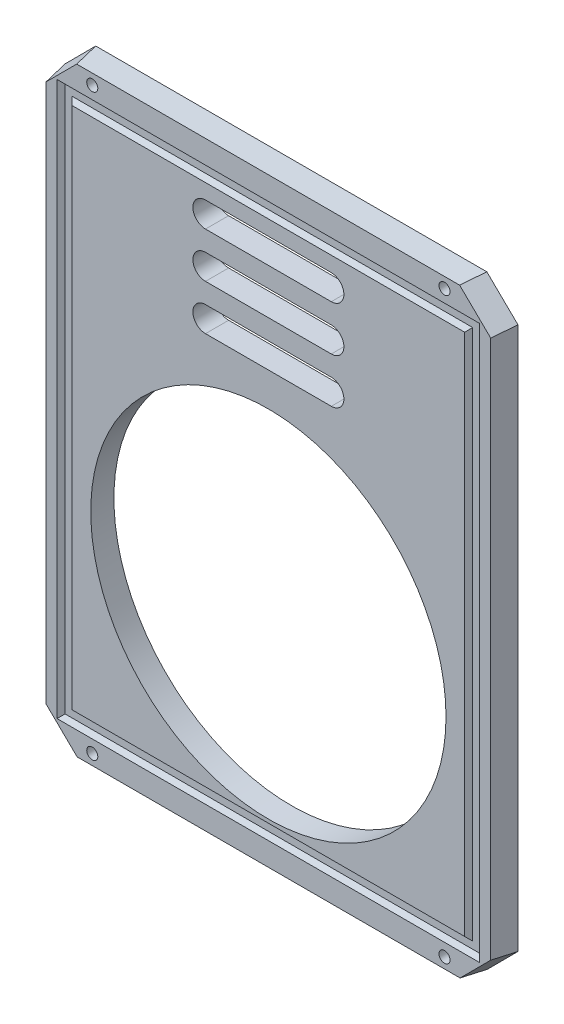
from build123d import *
from OCP.BRepFilletAPI import BRepFilletAPI_MakeChamfer

# Parameters (mm, degrees)
SKETCH1_W               = 114.3
SKETCH1_H               = 152.4
SKETCH1_R               = 44.831
SKETCH1_R_2             = 1.397
BOSS_EXTRUDE1_DEPTH     = 5.842
DRAFT1_ANGLE            = -5
DRAFT2_ANGLE            = -10
SKETCH2_W               = 104.14
SKETCH2_H               = 137.16
SKETCH2_W_2             = 101.6
SKETCH2_H_2             = 134.62
CUT_EXTRUDE_THIN1_DEPTH = 1.016
CHAMFER2_SIZE           = 7.62
CHAMFER2_SIZE2          = 7.737996461
CUT_EXTRUDE1_DEPTH      = 7.62


with BuildPart() as part:
    # Sketch1 → Boss-Extrude1 (new body)
    with BuildSketch(Plane.XY):
        Rectangle(SKETCH1_W, SKETCH1_H)
        with Locations((0, -20.32)):
            Circle(SKETCH1_R, mode=Mode.SUBTRACT)
        with Locations((-44.45, 73.025)):
            Circle(SKETCH1_R_2, mode=Mode.SUBTRACT)
        with Locations((44.45, 73.025)):
            Circle(SKETCH1_R_2, mode=Mode.SUBTRACT)
        with Locations((44.45, -73.025)):
            Circle(SKETCH1_R_2, mode=Mode.SUBTRACT)
        with Locations((-44.45, -73.025)):
            Circle(SKETCH1_R_2, mode=Mode.SUBTRACT)
    extrude(amount=BOSS_EXTRUDE1_DEPTH)

    # Draft1
    draft1_faces = [part.faces().sort_by_distance(p)[0] for p in [
        (0, 76.2, 2.921),
        (0, -76.2, 2.921),
    ]]
    draft(draft1_faces, Plane(origin=(0, 0, 0), x_dir=(-1, 0, 0), z_dir=(0, 0, -1)), DRAFT1_ANGLE)

    # Draft2
    draft2_faces = [part.faces().sort_by_distance(p)[0] for p in [
        (57.15, 0, 2.917723595),
        (-57.15, 0, 2.917723595),
    ]]
    draft(draft2_faces, Plane(origin=(0, 0, 0), x_dir=(-1, 0, 0), z_dir=(0, 0, -1)), DRAFT2_ANGLE)

    # Sketch2 → Cut-Extrude-Thin1 (cut)
    with BuildSketch(Plane.XY.offset(5.842)):
        Rectangle(SKETCH2_W, SKETCH2_H)
        Rectangle(SKETCH2_W_2, SKETCH2_H_2, mode=Mode.SUBTRACT)
    extrude(amount=-CUT_EXTRUDE_THIN1_DEPTH, mode=Mode.SUBTRACT)

    # Chamfer1
    # the kernel refuses this chamfer: 1.27 mm, written as the material it takes off along each edge
    with BuildSketch(Plane(origin=(50.8, 67.31, 5.842), x_dir=(-0.9996219169112968, 0, 0.02749587661058659), z_dir=(0, -1, 0))) as chamfer1_piece_1_section:
        with BuildLine():
            Line((1.306414958, 0), (-0.071814887, 1.304439598))
            Line((-0.071814887, 1.304439598), (-0.097205283, 1.303741203))
            ThreePointArc((-0.097205283, 1.303741203), (-0.043344118, 0.652015244), (-0.025390397, -0.000698395))
            Line((-0.025390397, -0.000698395), (0.000698395, -0.025390397))
            ThreePointArc((0.000698395, -0.025390397), (0.653412034, -0.007436675), (1.307113353, -0.025390397))
            Line((1.307113353, -0.025390397), (1.306414958, 0))
        make_face()
    chamfer1_piece_1 = extrude(amount=134.62, mode=Mode.PRIVATE)
    chamfer1_piece_1 = split(chamfer1_piece_1, bisect_by=Plane(origin=(50.360937616, 0, 4.826), z_dir=(0, 0, 1)), keep=Keep.TOP, mode=Mode.PRIVATE)
    add(chamfer1_piece_1, mode=Mode.SUBTRACT)
    with BuildSketch(Plane(origin=(50.8, -67.31, 5.842), x_dir=(0, 0.9996219169112968, 0.02749587661058659), z_dir=(-1, 0, 0))) as chamfer1_piece_2_section:
        with BuildLine():
            Line((1.306414958, 0), (-0.071814887, 1.304439598))
            Line((-0.071814887, 1.304439598), (-0.097205283, 1.303741203))
            ThreePointArc((-0.097205283, 1.303741203), (-0.043344118, 0.652015244), (-0.025390397, -0.000698395))
            Line((-0.025390397, -0.000698395), (0.000698395, -0.025390397))
            ThreePointArc((0.000698395, -0.025390397), (0.653412034, -0.007436675), (1.307113353, -0.025390397))
            Line((1.307113353, -0.025390397), (1.306414958, 0))
        make_face()
    chamfer1_piece_2 = extrude(amount=101.6, mode=Mode.PRIVATE)
    chamfer1_piece_2 = split(chamfer1_piece_2, bisect_by=Plane(origin=(0, -66.870937616, 4.826), z_dir=(0, 0, 1)), keep=Keep.TOP, mode=Mode.PRIVATE)
    add(chamfer1_piece_2, mode=Mode.SUBTRACT)
    with BuildSketch(Plane(origin=(-50.8, -67.31, 5.842), x_dir=(0.9996219169112968, 0, 0.02749587661058659), z_dir=(0, 1, 0))) as chamfer1_piece_3_section:
        with BuildLine():
            Line((1.306414958, 0), (-0.071814887, 1.304439598))
            Line((-0.071814887, 1.304439598), (-0.097205283, 1.303741203))
            ThreePointArc((-0.097205283, 1.303741203), (-0.043344118, 0.652015244), (-0.025390397, -0.000698395))
            Line((-0.025390397, -0.000698395), (0.000698395, -0.025390397))
            ThreePointArc((0.000698395, -0.025390397), (0.653412034, -0.007436675), (1.307113353, -0.025390397))
            Line((1.307113353, -0.025390397), (1.306414958, 0))
        make_face()
    chamfer1_piece_3 = extrude(amount=134.62, mode=Mode.PRIVATE)
    chamfer1_piece_3 = split(chamfer1_piece_3, bisect_by=Plane(origin=(-50.360937616, 0, 4.826), z_dir=(0, 0, 1)), keep=Keep.TOP, mode=Mode.PRIVATE)
    add(chamfer1_piece_3, mode=Mode.SUBTRACT)
    with BuildSketch(Plane(origin=(-50.8, 67.31, 5.842), x_dir=(0, -0.9996219169112968, 0.02749587661058659), z_dir=(1, 0, 0))) as chamfer1_piece_4_section:
        with BuildLine():
            Line((1.306414958, 0), (-0.071814887, 1.304439598))
            Line((-0.071814887, 1.304439598), (-0.097205283, 1.303741203))
            ThreePointArc((-0.097205283, 1.303741203), (-0.043344118, 0.652015244), (-0.025390397, -0.000698395))
            Line((-0.025390397, -0.000698395), (0.000698395, -0.025390397))
            ThreePointArc((0.000698395, -0.025390397), (0.653412034, -0.007436675), (1.307113353, -0.025390397))
            Line((1.307113353, -0.025390397), (1.306414958, 0))
        make_face()
    chamfer1_piece_4 = extrude(amount=101.6, mode=Mode.PRIVATE)
    chamfer1_piece_4 = split(chamfer1_piece_4, bisect_by=Plane(origin=(0, 66.870937616, 4.826), z_dir=(0, 0, 1)), keep=Keep.TOP, mode=Mode.PRIVATE)
    add(chamfer1_piece_4, mode=Mode.SUBTRACT)
    with BuildSketch(Plane(origin=(-52.07, 68.58, 5.842), x_dir=(0, 0.9996219169112968, 0.02749587661058659), z_dir=(1, 0, 0))) as chamfer1_piece_5_section:
        with BuildLine():
            Line((1.306414958, 0), (-0.071814887, -1.304439598))
            Line((-0.071814887, -1.304439598), (-0.097205283, -1.303741203))
            ThreePointArc((-0.097205283, -1.303741203), (-0.043344118, -0.652015244), (-0.025390397, 0.000698395))
            Line((-0.025390397, 0.000698395), (0.000698395, 0.025390397))
            ThreePointArc((0.000698395, 0.025390397), (0.653412034, 0.007436675), (1.307113353, 0.025390397))
            Line((1.307113353, 0.025390397), (1.306414958, 0))
        make_face()
    chamfer1_piece_5 = extrude(amount=104.14, mode=Mode.PRIVATE)
    chamfer1_piece_5 = split(chamfer1_piece_5, bisect_by=Plane(origin=(0, 69.019062384, 4.826), z_dir=(0, 0, 1)), keep=Keep.TOP, mode=Mode.PRIVATE)
    add(chamfer1_piece_5, mode=Mode.SUBTRACT)
    with BuildSketch(Plane(origin=(52.07, 68.58, 5.842), x_dir=(0.9996219169112968, 0, 0.02749587661058659), z_dir=(0, -1, 0))) as chamfer1_piece_6_section:
        with BuildLine():
            Line((1.306414958, 0), (-0.071814887, -1.304439598))
            Line((-0.071814887, -1.304439598), (-0.097205283, -1.303741203))
            ThreePointArc((-0.097205283, -1.303741203), (-0.043344118, -0.652015244), (-0.025390397, 0.000698395))
            Line((-0.025390397, 0.000698395), (0.000698395, 0.025390397))
            ThreePointArc((0.000698395, 0.025390397), (0.653412034, 0.007436675), (1.307113353, 0.025390397))
            Line((1.307113353, 0.025390397), (1.306414958, 0))
        make_face()
    chamfer1_piece_6 = extrude(amount=137.16, mode=Mode.PRIVATE)
    chamfer1_piece_6 = split(chamfer1_piece_6, bisect_by=Plane(origin=(52.509062384, 0, 4.826), z_dir=(0, 0, 1)), keep=Keep.TOP, mode=Mode.PRIVATE)
    add(chamfer1_piece_6, mode=Mode.SUBTRACT)
    with BuildSketch(Plane(origin=(-52.07, -68.58, 5.842), x_dir=(-0.9996219169112968, 0, 0.02749587661058659), z_dir=(0, 1, 0))) as chamfer1_piece_7_section:
        with BuildLine():
            Line((1.306414958, 0), (-0.071814887, -1.304439598))
            Line((-0.071814887, -1.304439598), (-0.097205283, -1.303741203))
            ThreePointArc((-0.097205283, -1.303741203), (-0.043344118, -0.652015244), (-0.025390397, 0.000698395))
            Line((-0.025390397, 0.000698395), (0.000698395, 0.025390397))
            ThreePointArc((0.000698395, 0.025390397), (0.653412034, 0.007436675), (1.307113353, 0.025390397))
            Line((1.307113353, 0.025390397), (1.306414958, 0))
        make_face()
    chamfer1_piece_7 = extrude(amount=137.16, mode=Mode.PRIVATE)
    chamfer1_piece_7 = split(chamfer1_piece_7, bisect_by=Plane(origin=(-52.509062384, 0, 4.826), z_dir=(0, 0, 1)), keep=Keep.TOP, mode=Mode.PRIVATE)
    add(chamfer1_piece_7, mode=Mode.SUBTRACT)
    with BuildSketch(Plane(origin=(52.07, -68.58, 5.842), x_dir=(0, -0.9996219169112968, 0.02749587661058659), z_dir=(-1, 0, 0))) as chamfer1_piece_8_section:
        with BuildLine():
            Line((1.306414958, 0), (-0.071814887, -1.304439598))
            Line((-0.071814887, -1.304439598), (-0.097205283, -1.303741203))
            ThreePointArc((-0.097205283, -1.303741203), (-0.043344118, -0.652015244), (-0.025390397, 0.000698395))
            Line((-0.025390397, 0.000698395), (0.000698395, 0.025390397))
            ThreePointArc((0.000698395, 0.025390397), (0.653412034, 0.007436675), (1.307113353, 0.025390397))
            Line((1.307113353, 0.025390397), (1.306414958, 0))
        make_face()
    chamfer1_piece_8 = extrude(amount=104.14, mode=Mode.PRIVATE)
    chamfer1_piece_8 = split(chamfer1_piece_8, bisect_by=Plane(origin=(0, -69.019062384, 4.826), z_dir=(0, 0, 1)), keep=Keep.TOP, mode=Mode.PRIVATE)
    add(chamfer1_piece_8, mode=Mode.SUBTRACT)
    with BuildSketch(Plane(origin=(50.8, 70.576037395, 5.842), x_dir=(-0.9996219169112968, 0, 0.02749587661058659), z_dir=(0, -1, 0))) as chamfer1_piece_9a_section:
        with BuildLine():
            Line((1.306414958, 0), (-0.071814887, 1.304439598))
            Line((-0.071814887, 1.304439598), (-0.097205283, 1.303741203))
            ThreePointArc((-0.097205283, 1.303741203), (-0.043344118, 0.652015244), (-0.025390397, -0.000698395))
            Line((-0.025390397, -0.000698395), (0.000698395, -0.025390397))
            ThreePointArc((0.000698395, -0.025390397), (0.653412034, -0.007436675), (1.307113353, -0.025390397))
            Line((1.307113353, -0.025390397), (1.306414958, 0))
        make_face()
    chamfer1_piece_9a = extrude(amount=137.886037395, mode=Mode.PRIVATE)
    chamfer1_piece_9a = split(chamfer1_piece_9a, bisect_by=Plane(origin=(50.360937616, 68.943018697, 4.826), z_dir=(0, 0, 1)), keep=Keep.TOP, mode=Mode.PRIVATE)
    chamfer1_piece_9a = split(chamfer1_piece_9a, bisect_by=Plane(origin=(50.360937616, 67.31, 5.461731684), z_dir=(0, 1, 0)), keep=Keep.TOP, mode=Mode.PRIVATE)
    with BuildSketch(Plane(origin=(-50.8, 67.31, 5.842), x_dir=(0, -0.9996219169112968, 0.02749587661058659), z_dir=(1, 0, 0))) as chamfer1_piece_9b_section:
        with BuildLine():
            Line((1.306414958, 0), (-0.071814887, 1.304439598))
            Line((-0.071814887, 1.304439598), (-0.097205283, 1.303741203))
            ThreePointArc((-0.097205283, 1.303741203), (-0.043344118, 0.652015244), (-0.025390397, -0.000698395))
            Line((-0.025390397, -0.000698395), (0.000698395, -0.025390397))
            ThreePointArc((0.000698395, -0.025390397), (0.653412034, -0.007436675), (1.307113353, -0.025390397))
            Line((1.307113353, -0.025390397), (1.306414958, 0))
        make_face()
    chamfer1_piece_9b = extrude(amount=104.866037395, mode=Mode.PRIVATE)
    chamfer1_piece_9b = split(chamfer1_piece_9b, bisect_by=Plane(origin=(52.433018697, 66.870937616, 4.826), z_dir=(0, 0, 1)), keep=Keep.TOP, mode=Mode.PRIVATE)
    chamfer1_piece_9b = split(chamfer1_piece_9b, bisect_by=Plane(origin=(50.8, 66.870937616, 5.461731684), z_dir=(1, 0, 0)), keep=Keep.TOP, mode=Mode.PRIVATE)
    chamfer1_piece_9 = chamfer1_piece_9a & chamfer1_piece_9b
    add(chamfer1_piece_9, mode=Mode.SUBTRACT)
    with BuildSketch(Plane(origin=(54.066037395, -67.31, 5.842), x_dir=(0, 0.9996219169112968, 0.02749587661058659), z_dir=(-1, 0, 0))) as chamfer1_piece_10a_section:
        with BuildLine():
            Line((1.306414958, 0), (-0.071814887, 1.304439598))
            Line((-0.071814887, 1.304439598), (-0.097205283, 1.303741203))
            ThreePointArc((-0.097205283, 1.303741203), (-0.043344118, 0.652015244), (-0.025390397, -0.000698395))
            Line((-0.025390397, -0.000698395), (0.000698395, -0.025390397))
            ThreePointArc((0.000698395, -0.025390397), (0.653412034, -0.007436675), (1.307113353, -0.025390397))
            Line((1.307113353, -0.025390397), (1.306414958, 0))
        make_face()
    chamfer1_piece_10a = extrude(amount=104.866037395, mode=Mode.PRIVATE)
    chamfer1_piece_10a = split(chamfer1_piece_10a, bisect_by=Plane(origin=(52.433018697, -66.870937616, 4.826), z_dir=(0, 0, 1)), keep=Keep.TOP, mode=Mode.PRIVATE)
    chamfer1_piece_10a = split(chamfer1_piece_10a, bisect_by=Plane(origin=(50.8, -66.870937616, 5.461731684), z_dir=(1, 0, 0)), keep=Keep.TOP, mode=Mode.PRIVATE)
    with BuildSketch(Plane(origin=(50.8, 67.31, 5.842), x_dir=(-0.9996219169112968, 0, 0.02749587661058659), z_dir=(0, -1, 0))) as chamfer1_piece_10b_section:
        with BuildLine():
            Line((1.306414958, 0), (-0.071814887, 1.304439598))
            Line((-0.071814887, 1.304439598), (-0.097205283, 1.303741203))
            ThreePointArc((-0.097205283, 1.303741203), (-0.043344118, 0.652015244), (-0.025390397, -0.000698395))
            Line((-0.025390397, -0.000698395), (0.000698395, -0.025390397))
            ThreePointArc((0.000698395, -0.025390397), (0.653412034, -0.007436675), (1.307113353, -0.025390397))
            Line((1.307113353, -0.025390397), (1.306414958, 0))
        make_face()
    chamfer1_piece_10b = extrude(amount=137.886037395, mode=Mode.PRIVATE)
    chamfer1_piece_10b = split(chamfer1_piece_10b, bisect_by=Plane(origin=(50.360937616, -68.943018697, 4.826), z_dir=(0, 0, 1)), keep=Keep.TOP, mode=Mode.PRIVATE)
    chamfer1_piece_10b = split(chamfer1_piece_10b, bisect_by=Plane(origin=(50.360937616, -67.31, 5.461731684), z_dir=(0, -1, 0)), keep=Keep.TOP, mode=Mode.PRIVATE)
    chamfer1_piece_10 = chamfer1_piece_10a & chamfer1_piece_10b
    add(chamfer1_piece_10, mode=Mode.SUBTRACT)
    with BuildSketch(Plane(origin=(50.8, -67.31, 5.842), x_dir=(0, 0.9996219169112968, 0.02749587661058659), z_dir=(-1, 0, 0))) as chamfer1_piece_11a_section:
        with BuildLine():
            Line((1.306414958, 0), (-0.071814887, 1.304439598))
            Line((-0.071814887, 1.304439598), (-0.097205283, 1.303741203))
            ThreePointArc((-0.097205283, 1.303741203), (-0.043344118, 0.652015244), (-0.025390397, -0.000698395))
            Line((-0.025390397, -0.000698395), (0.000698395, -0.025390397))
            ThreePointArc((0.000698395, -0.025390397), (0.653412034, -0.007436675), (1.307113353, -0.025390397))
            Line((1.307113353, -0.025390397), (1.306414958, 0))
        make_face()
    chamfer1_piece_11a = extrude(amount=104.866037395, mode=Mode.PRIVATE)
    chamfer1_piece_11a = split(chamfer1_piece_11a, bisect_by=Plane(origin=(-52.433018697, -66.870937616, 4.826), z_dir=(0, 0, 1)), keep=Keep.TOP, mode=Mode.PRIVATE)
    chamfer1_piece_11a = split(chamfer1_piece_11a, bisect_by=Plane(origin=(-50.8, -66.870937616, 5.461731684), z_dir=(-1, 0, 0)), keep=Keep.TOP, mode=Mode.PRIVATE)
    with BuildSketch(Plane(origin=(-50.8, -70.576037395, 5.842), x_dir=(0.9996219169112968, 0, 0.02749587661058659), z_dir=(0, 1, 0))) as chamfer1_piece_11b_section:
        with BuildLine():
            Line((1.306414958, 0), (-0.071814887, 1.304439598))
            Line((-0.071814887, 1.304439598), (-0.097205283, 1.303741203))
            ThreePointArc((-0.097205283, 1.303741203), (-0.043344118, 0.652015244), (-0.025390397, -0.000698395))
            Line((-0.025390397, -0.000698395), (0.000698395, -0.025390397))
            ThreePointArc((0.000698395, -0.025390397), (0.653412034, -0.007436675), (1.307113353, -0.025390397))
            Line((1.307113353, -0.025390397), (1.306414958, 0))
        make_face()
    chamfer1_piece_11b = extrude(amount=137.886037395, mode=Mode.PRIVATE)
    chamfer1_piece_11b = split(chamfer1_piece_11b, bisect_by=Plane(origin=(-50.360937616, -68.943018697, 4.826), z_dir=(0, 0, 1)), keep=Keep.TOP, mode=Mode.PRIVATE)
    chamfer1_piece_11b = split(chamfer1_piece_11b, bisect_by=Plane(origin=(-50.360937616, -67.31, 5.461731684), z_dir=(0, -1, 0)), keep=Keep.TOP, mode=Mode.PRIVATE)
    chamfer1_piece_11 = chamfer1_piece_11a & chamfer1_piece_11b
    add(chamfer1_piece_11, mode=Mode.SUBTRACT)
    with BuildSketch(Plane(origin=(-54.066037395, 67.31, 5.842), x_dir=(0, -0.9996219169112968, 0.02749587661058659), z_dir=(1, 0, 0))) as chamfer1_piece_12a_section:
        with BuildLine():
            Line((1.306414958, 0), (-0.071814887, 1.304439598))
            Line((-0.071814887, 1.304439598), (-0.097205283, 1.303741203))
            ThreePointArc((-0.097205283, 1.303741203), (-0.043344118, 0.652015244), (-0.025390397, -0.000698395))
            Line((-0.025390397, -0.000698395), (0.000698395, -0.025390397))
            ThreePointArc((0.000698395, -0.025390397), (0.653412034, -0.007436675), (1.307113353, -0.025390397))
            Line((1.307113353, -0.025390397), (1.306414958, 0))
        make_face()
    chamfer1_piece_12a = extrude(amount=104.866037395, mode=Mode.PRIVATE)
    chamfer1_piece_12a = split(chamfer1_piece_12a, bisect_by=Plane(origin=(-52.433018697, 66.870937616, 4.826), z_dir=(0, 0, 1)), keep=Keep.TOP, mode=Mode.PRIVATE)
    chamfer1_piece_12a = split(chamfer1_piece_12a, bisect_by=Plane(origin=(-50.8, 66.870937616, 5.461731684), z_dir=(-1, 0, 0)), keep=Keep.TOP, mode=Mode.PRIVATE)
    with BuildSketch(Plane(origin=(-50.8, -67.31, 5.842), x_dir=(0.9996219169112968, 0, 0.02749587661058659), z_dir=(0, 1, 0))) as chamfer1_piece_12b_section:
        with BuildLine():
            Line((1.306414958, 0), (-0.071814887, 1.304439598))
            Line((-0.071814887, 1.304439598), (-0.097205283, 1.303741203))
            ThreePointArc((-0.097205283, 1.303741203), (-0.043344118, 0.652015244), (-0.025390397, -0.000698395))
            Line((-0.025390397, -0.000698395), (0.000698395, -0.025390397))
            ThreePointArc((0.000698395, -0.025390397), (0.653412034, -0.007436675), (1.307113353, -0.025390397))
            Line((1.307113353, -0.025390397), (1.306414958, 0))
        make_face()
    chamfer1_piece_12b = extrude(amount=137.886037395, mode=Mode.PRIVATE)
    chamfer1_piece_12b = split(chamfer1_piece_12b, bisect_by=Plane(origin=(-50.360937616, 68.943018697, 4.826), z_dir=(0, 0, 1)), keep=Keep.TOP, mode=Mode.PRIVATE)
    chamfer1_piece_12b = split(chamfer1_piece_12b, bisect_by=Plane(origin=(-50.360937616, 67.31, 5.461731684), z_dir=(0, 1, 0)), keep=Keep.TOP, mode=Mode.PRIVATE)
    chamfer1_piece_12 = chamfer1_piece_12a & chamfer1_piece_12b
    add(chamfer1_piece_12, mode=Mode.SUBTRACT)
    with BuildSketch(Plane(origin=(-55.336037395, 68.58, 5.842), x_dir=(0, 0.9996219169112968, 0.02749587661058659), z_dir=(1, 0, 0))) as chamfer1_piece_13a_section:
        with BuildLine():
            Line((1.306414958, 0), (-0.071814887, -1.304439598))
            Line((-0.071814887, -1.304439598), (-0.097205283, -1.303741203))
            ThreePointArc((-0.097205283, -1.303741203), (-0.043344118, -0.652015244), (-0.025390397, 0.000698395))
            Line((-0.025390397, 0.000698395), (0.000698395, 0.025390397))
            ThreePointArc((0.000698395, 0.025390397), (0.653412034, 0.007436675), (1.307113353, 0.025390397))
            Line((1.307113353, 0.025390397), (1.306414958, 0))
        make_face()
    chamfer1_piece_13a = extrude(amount=107.406037395, mode=Mode.PRIVATE)
    chamfer1_piece_13a = split(chamfer1_piece_13a, bisect_by=Plane(origin=(-52.07, 69.019062384, 5.461731684), z_dir=(-1, 0, 0)), keep=Keep.TOP, mode=Mode.PRIVATE)
    chamfer1_piece_13a = split(chamfer1_piece_13a, bisect_by=Plane(origin=(-53.703018697, 69.019062384, 4.826), z_dir=(0, 0, 1)), keep=Keep.TOP, mode=Mode.PRIVATE)
    with BuildSketch(Plane(origin=(-52.07, -68.58, 5.842), x_dir=(-0.9996219169112968, 0, 0.02749587661058659), z_dir=(0, 1, 0))) as chamfer1_piece_13b_section:
        with BuildLine():
            Line((1.306414958, 0), (-0.071814887, -1.304439598))
            Line((-0.071814887, -1.304439598), (-0.097205283, -1.303741203))
            ThreePointArc((-0.097205283, -1.303741203), (-0.043344118, -0.652015244), (-0.025390397, 0.000698395))
            Line((-0.025390397, 0.000698395), (0.000698395, 0.025390397))
            ThreePointArc((0.000698395, 0.025390397), (0.653412034, 0.007436675), (1.307113353, 0.025390397))
            Line((1.307113353, 0.025390397), (1.306414958, 0))
        make_face()
    chamfer1_piece_13b = extrude(amount=140.426037395, mode=Mode.PRIVATE)
    chamfer1_piece_13b = split(chamfer1_piece_13b, bisect_by=Plane(origin=(-52.509062384, 68.58, 5.461731684), z_dir=(0, 1, 0)), keep=Keep.TOP, mode=Mode.PRIVATE)
    chamfer1_piece_13b = split(chamfer1_piece_13b, bisect_by=Plane(origin=(-52.509062384, 70.213018697, 4.826), z_dir=(0, 0, 1)), keep=Keep.TOP, mode=Mode.PRIVATE)
    chamfer1_piece_13 = chamfer1_piece_13a & chamfer1_piece_13b
    add(chamfer1_piece_13, mode=Mode.SUBTRACT)
    with BuildSketch(Plane(origin=(-52.07, 68.58, 5.842), x_dir=(0, 0.9996219169112968, 0.02749587661058659), z_dir=(1, 0, 0))) as chamfer1_piece_14a_section:
        with BuildLine():
            Line((1.306414958, 0), (-0.071814887, -1.304439598))
            Line((-0.071814887, -1.304439598), (-0.097205283, -1.303741203))
            ThreePointArc((-0.097205283, -1.303741203), (-0.043344118, -0.652015244), (-0.025390397, 0.000698395))
            Line((-0.025390397, 0.000698395), (0.000698395, 0.025390397))
            ThreePointArc((0.000698395, 0.025390397), (0.653412034, 0.007436675), (1.307113353, 0.025390397))
            Line((1.307113353, 0.025390397), (1.306414958, 0))
        make_face()
    chamfer1_piece_14a = extrude(amount=107.406037395, mode=Mode.PRIVATE)
    chamfer1_piece_14a = split(chamfer1_piece_14a, bisect_by=Plane(origin=(52.07, 69.019062384, 5.461731684), z_dir=(1, 0, 0)), keep=Keep.TOP, mode=Mode.PRIVATE)
    chamfer1_piece_14a = split(chamfer1_piece_14a, bisect_by=Plane(origin=(53.703018697, 69.019062384, 4.826), z_dir=(0, 0, 1)), keep=Keep.TOP, mode=Mode.PRIVATE)
    with BuildSketch(Plane(origin=(52.07, 71.846037395, 5.842), x_dir=(0.9996219169112968, 0, 0.02749587661058659), z_dir=(0, -1, 0))) as chamfer1_piece_14b_section:
        with BuildLine():
            Line((1.306414958, 0), (-0.071814887, -1.304439598))
            Line((-0.071814887, -1.304439598), (-0.097205283, -1.303741203))
            ThreePointArc((-0.097205283, -1.303741203), (-0.043344118, -0.652015244), (-0.025390397, 0.000698395))
            Line((-0.025390397, 0.000698395), (0.000698395, 0.025390397))
            ThreePointArc((0.000698395, 0.025390397), (0.653412034, 0.007436675), (1.307113353, 0.025390397))
            Line((1.307113353, 0.025390397), (1.306414958, 0))
        make_face()
    chamfer1_piece_14b = extrude(amount=140.426037395, mode=Mode.PRIVATE)
    chamfer1_piece_14b = split(chamfer1_piece_14b, bisect_by=Plane(origin=(52.509062384, 68.58, 5.461731684), z_dir=(0, 1, 0)), keep=Keep.TOP, mode=Mode.PRIVATE)
    chamfer1_piece_14b = split(chamfer1_piece_14b, bisect_by=Plane(origin=(52.509062384, 70.213018697, 4.826), z_dir=(0, 0, 1)), keep=Keep.TOP, mode=Mode.PRIVATE)
    chamfer1_piece_14 = chamfer1_piece_14a & chamfer1_piece_14b
    add(chamfer1_piece_14, mode=Mode.SUBTRACT)
    with BuildSketch(Plane(origin=(52.07, 68.58, 5.842), x_dir=(0.9996219169112968, 0, 0.02749587661058659), z_dir=(0, -1, 0))) as chamfer1_piece_15a_section:
        with BuildLine():
            Line((1.306414958, 0), (-0.071814887, -1.304439598))
            Line((-0.071814887, -1.304439598), (-0.097205283, -1.303741203))
            ThreePointArc((-0.097205283, -1.303741203), (-0.043344118, -0.652015244), (-0.025390397, 0.000698395))
            Line((-0.025390397, 0.000698395), (0.000698395, 0.025390397))
            ThreePointArc((0.000698395, 0.025390397), (0.653412034, 0.007436675), (1.307113353, 0.025390397))
            Line((1.307113353, 0.025390397), (1.306414958, 0))
        make_face()
    chamfer1_piece_15a = extrude(amount=140.426037395, mode=Mode.PRIVATE)
    chamfer1_piece_15a = split(chamfer1_piece_15a, bisect_by=Plane(origin=(52.509062384, -68.58, 5.461731684), z_dir=(0, -1, 0)), keep=Keep.TOP, mode=Mode.PRIVATE)
    chamfer1_piece_15a = split(chamfer1_piece_15a, bisect_by=Plane(origin=(52.509062384, -70.213018697, 4.826), z_dir=(0, 0, 1)), keep=Keep.TOP, mode=Mode.PRIVATE)
    with BuildSketch(Plane(origin=(55.336037395, -68.58, 5.842), x_dir=(0, -0.9996219169112968, 0.02749587661058659), z_dir=(-1, 0, 0))) as chamfer1_piece_15b_section:
        with BuildLine():
            Line((1.306414958, 0), (-0.071814887, -1.304439598))
            Line((-0.071814887, -1.304439598), (-0.097205283, -1.303741203))
            ThreePointArc((-0.097205283, -1.303741203), (-0.043344118, -0.652015244), (-0.025390397, 0.000698395))
            Line((-0.025390397, 0.000698395), (0.000698395, 0.025390397))
            ThreePointArc((0.000698395, 0.025390397), (0.653412034, 0.007436675), (1.307113353, 0.025390397))
            Line((1.307113353, 0.025390397), (1.306414958, 0))
        make_face()
    chamfer1_piece_15b = extrude(amount=107.406037395, mode=Mode.PRIVATE)
    chamfer1_piece_15b = split(chamfer1_piece_15b, bisect_by=Plane(origin=(52.07, -69.019062384, 5.461731684), z_dir=(1, 0, 0)), keep=Keep.TOP, mode=Mode.PRIVATE)
    chamfer1_piece_15b = split(chamfer1_piece_15b, bisect_by=Plane(origin=(53.703018697, -69.019062384, 4.826), z_dir=(0, 0, 1)), keep=Keep.TOP, mode=Mode.PRIVATE)
    chamfer1_piece_15 = chamfer1_piece_15a & chamfer1_piece_15b
    add(chamfer1_piece_15, mode=Mode.SUBTRACT)
    with BuildSketch(Plane(origin=(52.07, -68.58, 5.842), x_dir=(0, -0.9996219169112968, 0.02749587661058659), z_dir=(-1, 0, 0))) as chamfer1_piece_16a_section:
        with BuildLine():
            Line((1.306414958, 0), (-0.071814887, -1.304439598))
            Line((-0.071814887, -1.304439598), (-0.097205283, -1.303741203))
            ThreePointArc((-0.097205283, -1.303741203), (-0.043344118, -0.652015244), (-0.025390397, 0.000698395))
            Line((-0.025390397, 0.000698395), (0.000698395, 0.025390397))
            ThreePointArc((0.000698395, 0.025390397), (0.653412034, 0.007436675), (1.307113353, 0.025390397))
            Line((1.307113353, 0.025390397), (1.306414958, 0))
        make_face()
    chamfer1_piece_16a = extrude(amount=107.406037395, mode=Mode.PRIVATE)
    chamfer1_piece_16a = split(chamfer1_piece_16a, bisect_by=Plane(origin=(-52.07, -69.019062384, 5.461731684), z_dir=(-1, 0, 0)), keep=Keep.TOP, mode=Mode.PRIVATE)
    chamfer1_piece_16a = split(chamfer1_piece_16a, bisect_by=Plane(origin=(-53.703018697, -69.019062384, 4.826), z_dir=(0, 0, 1)), keep=Keep.TOP, mode=Mode.PRIVATE)
    with BuildSketch(Plane(origin=(-52.07, -71.846037395, 5.842), x_dir=(-0.9996219169112968, 0, 0.02749587661058659), z_dir=(0, 1, 0))) as chamfer1_piece_16b_section:
        with BuildLine():
            Line((1.306414958, 0), (-0.071814887, -1.304439598))
            Line((-0.071814887, -1.304439598), (-0.097205283, -1.303741203))
            ThreePointArc((-0.097205283, -1.303741203), (-0.043344118, -0.652015244), (-0.025390397, 0.000698395))
            Line((-0.025390397, 0.000698395), (0.000698395, 0.025390397))
            ThreePointArc((0.000698395, 0.025390397), (0.653412034, 0.007436675), (1.307113353, 0.025390397))
            Line((1.307113353, 0.025390397), (1.306414958, 0))
        make_face()
    chamfer1_piece_16b = extrude(amount=140.426037395, mode=Mode.PRIVATE)
    chamfer1_piece_16b = split(chamfer1_piece_16b, bisect_by=Plane(origin=(-52.509062384, -68.58, 5.461731684), z_dir=(0, -1, 0)), keep=Keep.TOP, mode=Mode.PRIVATE)
    chamfer1_piece_16b = split(chamfer1_piece_16b, bisect_by=Plane(origin=(-52.509062384, -70.213018697, 4.826), z_dir=(0, 0, 1)), keep=Keep.TOP, mode=Mode.PRIVATE)
    chamfer1_piece_16 = chamfer1_piece_16a & chamfer1_piece_16b
    add(chamfer1_piece_16, mode=Mode.SUBTRACT)

    # Chamfer2: one chamfer whose edges measure the first distance from different faces: ONE call of the kernel's chamfer builder (chamfer() names one face for all edges)
    chamfer2_edges_1 = [part.edges().sort_by_distance(p)[0] for p in [
        (-56.634948889, 75.944445614, 2.921),
    ]]
    chamfer2_side_1 = [part.faces().sort_by_distance(p)[0] for p in [
        (0, 75.945220304, 2.912145254),
    ]]
    chamfer2_edges_2 = [part.edges().sort_by_distance(p)[0] for p in [
        (56.634948889, 75.944445614, 2.921),
    ]]
    chamfer2_side_2 = [part.faces().sort_by_distance(p)[0] for p in [
        (56.635526608, 0, 2.917723595),
    ]]
    chamfer2_edges_3 = [part.edges().sort_by_distance(p)[0] for p in [
        (56.634948889, -75.944445614, 2.921),
    ]]
    chamfer2_side_3 = [part.faces().sort_by_distance(p)[0] for p in [
        (0, -75.945220304, 2.912145254),
    ]]
    chamfer2_edges_4 = [part.edges().sort_by_distance(p)[0] for p in [
        (-56.634948889, -75.944445614, 2.921),
    ]]
    chamfer2_side_4 = [part.faces().sort_by_distance(p)[0] for p in [
        (-56.635526608, 0, 2.917723595),
    ]]
    chamfer2 = BRepFilletAPI_MakeChamfer(part.part.solid().wrapped)
    for e in chamfer2_edges_1:
        chamfer2.Add(CHAMFER2_SIZE, CHAMFER2_SIZE2, e.wrapped, chamfer2_side_1[0].wrapped)  # the first distance lies on this face
    for e in chamfer2_edges_2:
        chamfer2.Add(CHAMFER2_SIZE, CHAMFER2_SIZE2, e.wrapped, chamfer2_side_2[0].wrapped)  # the first distance lies on this face
    for e in chamfer2_edges_3:
        chamfer2.Add(CHAMFER2_SIZE, CHAMFER2_SIZE2, e.wrapped, chamfer2_side_3[0].wrapped)  # the first distance lies on this face
    for e in chamfer2_edges_4:
        chamfer2.Add(CHAMFER2_SIZE, CHAMFER2_SIZE2, e.wrapped, chamfer2_side_4[0].wrapped)  # the first distance lies on this face
    add(Compound.cast(chamfer2.Shape()), mode=Mode.REPLACE)

    # Sketch3 → Cut-Extrude1 (cut)
    with BuildSketch(Plane.XY.offset(5.842)):
        with BuildLine():
            Line((15.875, 55.88), (-15.875, 55.88))
            ThreePointArc((-15.875, 55.88), (-19.05, 59.055), (-15.875, 62.23))
            Line((-15.875, 62.23), (15.875, 62.23))
            ThreePointArc((15.875, 62.23), (19.05, 59.055), (15.875, 55.88))
        make_face()
        with BuildLine():
            Line((15.875, 44.45), (-15.875, 44.45))
            ThreePointArc((-15.875, 44.45), (-19.05, 47.625), (-15.875, 50.8))
            Line((-15.875, 50.8), (15.875, 50.8))
            ThreePointArc((15.875, 50.8), (19.05, 47.625), (15.875, 44.45))
        make_face()
        with BuildLine():
            Line((15.875, 33.02), (-15.875, 33.02))
            ThreePointArc((-15.875, 33.02), (-19.05, 36.195), (-15.875, 39.37))
            Line((-15.875, 39.37), (15.875, 39.37))
            ThreePointArc((15.875, 39.37), (19.05, 36.195), (15.875, 33.02))
        make_face()
    extrude(amount=-CUT_EXTRUDE1_DEPTH, mode=Mode.SUBTRACT)


solid = part.part
